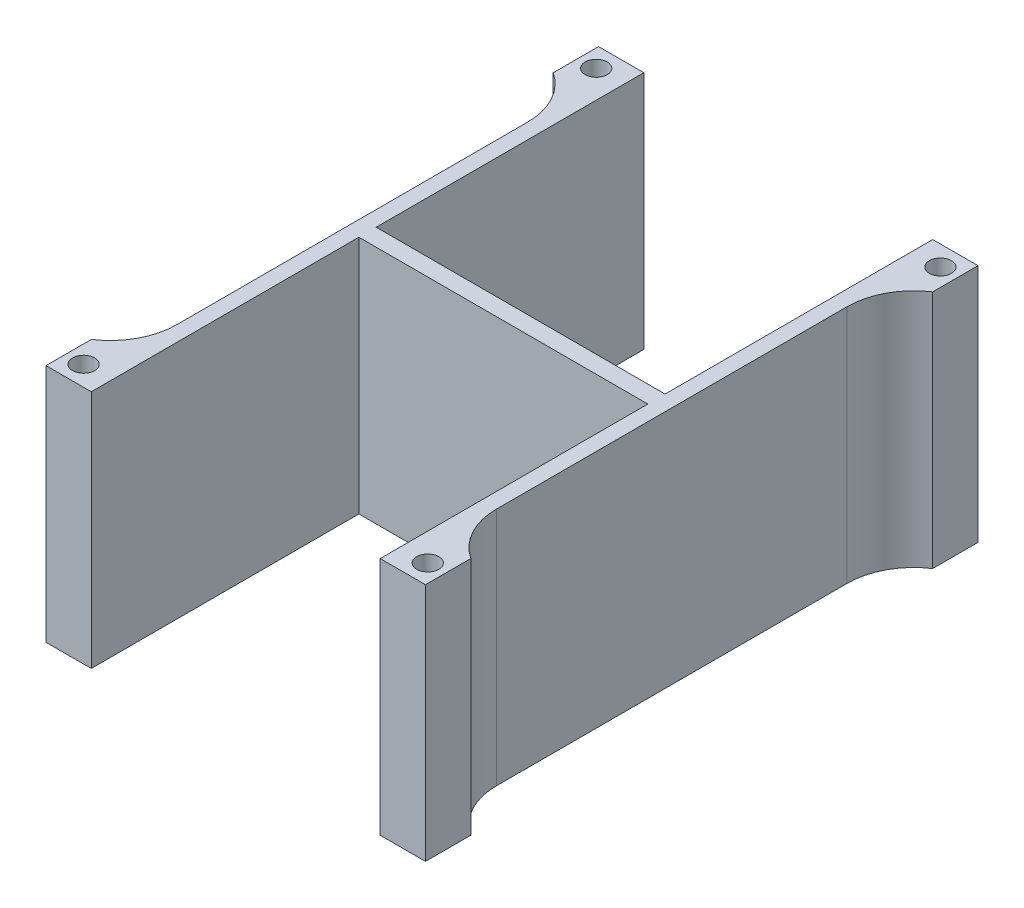
from build123d import *

# Parameters (mm, degrees)
ESQUISSE1_W                  = 43
ESQUISSE1_H                  = 43
BOSS_EXTRU_1_DEPTH           = 40
ESQUISSE2_W                  = 48
ESQUISSE2_H                  = 48
BOSS_EXTRU_2_DEPTH           = 1.5
ENL_V_MAT_EXTRU_3_REACH      = 79.293
ESQUISSE5_W                  = 8
ESQUISSE5_H                  = 5
ENL_V_MAT_EXTRU_4_REACH      = 78.569
ESQUISSE6_W                  = 54.781223227
ESQUISSE6_H                  = 3.078773465
ENL_V_MAT_EXTRU_5_DEPTH      = 9.5
ENL_V_MAT_EXTRU_6_DEPTH      = 73.216687822
ENL_V_MAT_EXTRU_6_DEPTH_BACK = 73.216687822
ESQUISSE9_W                  = 82.255914314
ESQUISSE9_H                  = 90.950558943
ENL_V_MAT_EXTRU_7_DEPTH      = 9.5
ESQUISSE10_W                 = 6
ESQUISSE10_H                 = 36
BOSS_EXTRU_3_DEPTH           = 6
CONG_1_R                     = 10
ESQUISSE11_W                 = 6
ESQUISSE11_H                 = 36
BOSS_EXTRU_4_DEPTH           = 6
CONG_2_R                     = 10
ESQUISSE12_R                 = 1.66
ENL_V_MAT_EXTRU_8_DEPTH      = 10
ESQUISSE13_W                 = 5.657897309
ESQUISSE13_H                 = 15.126215254
ENL_V_MAT_EXTRU_9_DEPTH      = 77.139674284


with BuildPart() as part:
    # Esquisse1 → Boss.-Extru.1 (new body)
    with BuildSketch(Plane.XY):
        Polygon((-2.5, 43), (-2.5, -2.5), (0, -2.5), (45.5, -2.5), (45.5, 43), (45.5, 45.5), (-2.5, 45.5), align=None)
        with Locations((21.5, 21.5)):
            Rectangle(ESQUISSE1_W, ESQUISSE1_H, mode=Mode.SUBTRACT)
    extrude(amount=BOSS_EXTRU_1_DEPTH)

    # Esquisse2 → Boss.-Extru.2 (add)
    with BuildSketch(Plane.XY):
        with Locations((21.5, 21.5)):
            Rectangle(ESQUISSE2_W, ESQUISSE2_H)
    extrude(amount=-BOSS_EXTRU_2_DEPTH)

    # Esquisse5 → Enlèv. mat.-Extru.3 (cut, up to next)
    with BuildSketch(Plane(origin=(0, 45.5, 0), x_dir=(1, 0, 0), z_dir=(0, 1, 0)), mode=Mode.PRIVATE) as enl_v_mat_extru_3_sk1:
        with Locations((21.5, -6.3)):
            Rectangle(ESQUISSE5_W, ESQUISSE5_H)
    enl_v_mat_extru_3_tool1 = extrude(enl_v_mat_extru_3_sk1.sketch, amount=-ENL_V_MAT_EXTRU_3_REACH, mode=Mode.PRIVATE) & part.part
    add(enl_v_mat_extru_3_tool1.solids().sort_by_distance((21.5, 45.5, 6.3))[0], mode=Mode.SUBTRACT)

    # Esquisse6 → Enlèv. mat.-Extru.4 (cut, up to next)
    with BuildSketch(Plane.XY.offset(40), mode=Mode.PRIVATE) as enl_v_mat_extru_4_sk1:
        with Locations((23.162986277, -1.539386733)):
            Rectangle(ESQUISSE6_W, ESQUISSE6_H)
    enl_v_mat_extru_4_tool1 = extrude(enl_v_mat_extru_4_sk1.sketch, amount=-ENL_V_MAT_EXTRU_4_REACH, mode=Mode.PRIVATE) & part.part
    add(enl_v_mat_extru_4_tool1.solids().sort_by_distance((23.162986, -1.539387, 40))[0], mode=Mode.SUBTRACT)

    # Symétrie1: part across plane


with BuildPart() as part_1:
    add(part.part)
    add(part.part.mirror(Plane.XY.offset(-1.5)))

    # Esquisse7 → Enlèv. mat.-Extru.5 (cut)
    with BuildSketch(Plane(origin=(0, 45.5, 0), x_dir=(1, 0, 0), z_dir=(0, 1, 0))):
        Polygon((-2.5, 7.8), (0, 7.8), (0, 12.8), (-2.5, 12.8), (-2.5, 25.4), (0, 25.4), (0, 30.4), (-2.5, 30.4), (-2.5, 43), (45.5, 43), (45.5, 30.4), (43, 30.4), (43, 25.4), (45.5, 25.4), (45.5, 12.8), (43, 12.8), (43, 7.8), (45.5, 7.8), (45.5, -4.8), (43, -4.8), (43, -9.8), (45.5, -9.8), (45.5, -22.4), (43, -22.4), (43, -27.4), (45.5, -27.4), (45.5, -40), (-2.5, -40), (-2.5, -27.4), (0, -27.4), (0, -22.4), (-2.5, -22.4), (-2.5, -9.8), (0, -9.8), (0, -4.8), (-2.5, -4.8), align=None)
    extrude(amount=-ENL_V_MAT_EXTRU_5_DEPTH, mode=Mode.SUBTRACT)

    # Esquisse8 → Enlèv. mat.-Extru.6 (cut, two sides: drawn at the far end of the back side and taken through both)
    with BuildSketch(Plane(origin=(0, 36, 0), x_dir=(1, 0, 0), z_dir=(0, 1, 0)).offset(-ENL_V_MAT_EXTRU_6_DEPTH_BACK)):
        Polygon((-0.2, 43), (-0.2, 2.8), (43.2, 2.8), (43.2, 43), (43, 43), (43, 3), (0, 3), (0, 43), align=None)
        Polygon((0, 0), (0, -40), (-0.2, -40), (-0.2, 0.2), (43.2, 0.2), (43.2, -40), (43, -40), (43, 0), align=None)
    extrude(amount=ENL_V_MAT_EXTRU_6_DEPTH + ENL_V_MAT_EXTRU_6_DEPTH_BACK, mode=Mode.SUBTRACT)

    # Esquisse9 → Enlèv. mat.-Extru.7 (cut)
    with BuildSketch(Plane(origin=(0, 45.5, 0), x_dir=(1, 0, 0), z_dir=(0, 1, 0))):
        with Locations((21.348833146, 1.614403219)):
            Rectangle(ESQUISSE9_W, ESQUISSE9_H)
    extrude(amount=-ENL_V_MAT_EXTRU_7_DEPTH, mode=Mode.SUBTRACT)

    # Esquisse10 → Boss.-Extru.3 (add)
    with BuildSketch(Plane(origin=(45.5, 0, 0), x_dir=(0, 0, -1), z_dir=(1, 0, 0))):
        with Locations((-37, 18)):
            Rectangle(ESQUISSE10_W, ESQUISSE10_H)
        with Locations((40, 18)):
            Rectangle(ESQUISSE10_W, ESQUISSE10_H)
    extrude(amount=BOSS_EXTRU_3_DEPTH)

    # Congé1
    # the kernel refuses this fillet: 10 mm, written as the material it adds along each edge
    with BuildSketch(Plane(origin=(45.5, 36, 34), x_dir=(1, 0, 0), z_dir=(0, -1, 0))) as cong_1_piece_1:
        with BuildLine():
            CenterArc((10, -9.16515139), CONG_1_R, 113.578178478, 66.421821522)
            Line((0, -9.16515139), (-0.2, -9.16515139))
            Line((-0.2, -9.16515139), (-0.2, 0))
            Line((-0.2, 0), (0, 0.2))
            ThreePointArc((0, 0.2), (3, 0.2), (5.92, 0.183303028))
            Line((5.92, 0.183303028), (6, 0))
        make_face()
    extrude(amount=36)
    with BuildSketch(Plane(origin=(45.5, 36, -37), x_dir=(0, 0, 1), z_dir=(0, -1, 0))) as cong_1_piece_2:
        with BuildLine():
            CenterArc((9.16515139, -10), CONG_1_R, 90, 66.421821522)
            Line((0, -6), (-0.183303028, -5.92))
            ThreePointArc((-0.183303028, -5.92), (-0.2, -3), (-0.2, 0))
            Line((-0.2, 0), (0, 0.2))
            Line((0, 0.2), (9.16515139, 0.2))
            Line((9.16515139, 0.2), (9.16515139, 0))
        make_face()
    extrude(amount=36)

    # Esquisse11 → Boss.-Extru.4 (add)
    with BuildSketch(Plane.ZY.offset(2.5)):
        with Locations((-40, 18)):
            Rectangle(ESQUISSE11_W, ESQUISSE11_H)
        with Locations((37, 18)):
            Rectangle(ESQUISSE11_W, ESQUISSE11_H)
    extrude(amount=BOSS_EXTRU_4_DEPTH)

    # Congé2
    # the kernel refuses this fillet: 10 mm, written as the material it adds along each edge
    with BuildSketch(Plane(origin=(-2.5, 0, 34), x_dir=(-1, 0, 0), z_dir=(0, 1, 0))) as cong_2_piece_1:
        with BuildLine():
            CenterArc((10, -9.16515139), CONG_2_R, 113.578178478, 66.421821522)
            Line((0, -9.16515139), (-0.2, -9.16515139))
            Line((-0.2, -9.16515139), (-0.2, 0))
            Line((-0.2, 0), (0, 0.2))
            ThreePointArc((0, 0.2), (3, 0.2), (5.92, 0.183303028))
            Line((5.92, 0.183303028), (6, 0))
        make_face()
    extrude(amount=36)
    with BuildSketch(Plane(origin=(-2.5, 36, -37), x_dir=(0, 0, 1), z_dir=(0, -1, 0))) as cong_2_piece_2:
        with BuildLine():
            CenterArc((9.16515139, 10), CONG_2_R, 203.578178478, 66.421821522)
            Line((0, 6), (-0.183303028, 5.92))
            ThreePointArc((-0.183303028, 5.92), (-0.2, 3), (-0.2, 0))
            Line((-0.2, 0), (0, -0.2))
            Line((0, -0.2), (9.16515139, -0.2))
            Line((9.16515139, -0.2), (9.16515139, 0))
        make_face()
    extrude(amount=36)

    # Esquisse12 → Enlèv. mat.-Extru.8 (cut)
    with BuildSketch(Plane(origin=(0, 36, 0), x_dir=(1, 0, 0), z_dir=(0, 1, 0))):
        with Locations(Location((-4.35, 40, 0), (0, 0, 180))):
            Circle(ESQUISSE12_R)
        with Locations((47.35, 40)):
            Circle(ESQUISSE12_R)
        with Locations(Location((47.35, -37, 0), (0, 0, 180))):
            Circle(ESQUISSE12_R)
        with Locations((-4.35, -37)):
            Circle(ESQUISSE12_R)
    extrude(amount=-ENL_V_MAT_EXTRU_8_DEPTH, mode=Mode.SUBTRACT)

    # Esquisse13 → Enlèv. mat.-Extru.9 (cut, through all)
    with BuildSketch(Plane(origin=(0, 36, 0), x_dir=(1, 0, 0), z_dir=(0, 1, 0))):
        with Locations((52.828948655, 38.373658998)):
            Rectangle(ESQUISSE13_W, ESQUISSE13_H)
        with Locations((52.828948655, -35.373658998)):
            Rectangle(ESQUISSE13_W, ESQUISSE13_H)
        with Locations((-9.828948654, 38.373658998)):
            Rectangle(ESQUISSE13_W, ESQUISSE13_H)
        with Locations((-9.828948654, -35.373658998)):
            Rectangle(ESQUISSE13_W, ESQUISSE13_H)
    extrude(amount=-ENL_V_MAT_EXTRU_9_DEPTH, mode=Mode.SUBTRACT)


solid = part_1.part
